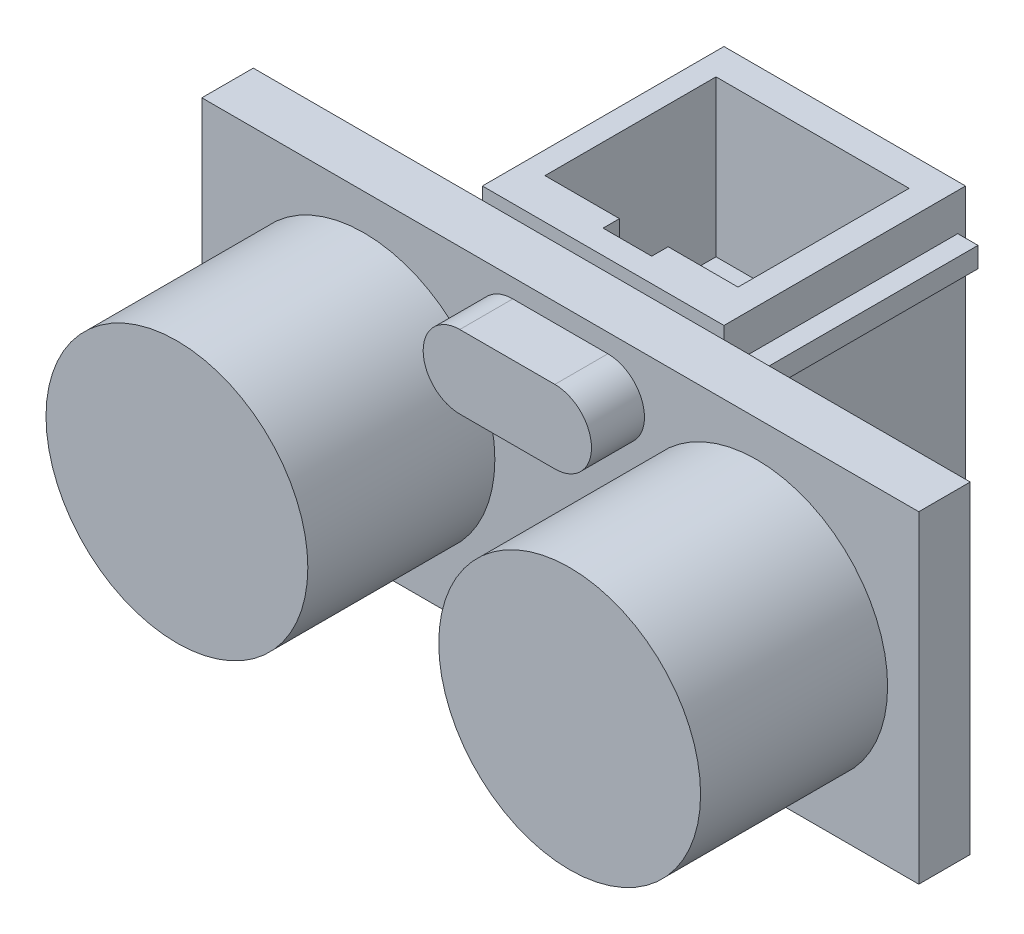
from build123d import *

# Parameters (mm, degrees)
SKETCH1_W           = 46
SKETCH1_H           = 20.7
BOSS_EXTRUDE1_DEPTH = 3.3
SKETCH2_R           = 8.4
BOSS_EXTRUDE2_DEPTH = 12
BOSS_EXTRUDE3_DEPTH = 3.4
SKETCH4_W           = 15.5
SKETCH4_H           = 21.5
BOSS_EXTRUDE4_DEPTH = 15.5
CUT_EXTRUDE1_DEPTH  = 36.729714524
SKETCH6_W           = 14
SKETCH6_H           = 1.3
BOSS_EXTRUDE5_DEPTH = 1.3
SKETCH7_W           = 14
SKETCH7_H           = 1.3
BOSS_EXTRUDE6_DEPTH = 1.3
CUT_EXTRUDE2_DEPTH  = 10


with BuildPart() as part:
    # Sketch1 → Boss-Extrude1 (new body)
    with BuildSketch(Plane.XY):
        Rectangle(SKETCH1_W, SKETCH1_H)
    extrude(amount=BOSS_EXTRUDE1_DEPTH)

    # Sketch2 → Boss-Extrude2 (add)
    with BuildSketch(Plane.XY.offset(3.3)):
        with Locations((-12.6, -0.35)):
            Circle(SKETCH2_R)
        with Locations((12.6, -0.35)):
            Circle(SKETCH2_R)
    extrude(amount=BOSS_EXTRUDE2_DEPTH)

    # Sketch3 → Boss-Extrude3 (add)
    with BuildSketch(Plane.XY.offset(3.3)):
        with BuildLine():
            Line((-3.05, 9.15), (3.05, 9.15))
            ThreePointArc((3.05, 9.15), (5.4, 6.8), (3.05, 4.45))
            Line((3.05, 4.45), (-3.05, 4.45))
            ThreePointArc((-3.05, 4.45), (-5.4, 6.8), (-3.05, 9.15))
        make_face()
    extrude(amount=BOSS_EXTRUDE3_DEPTH)

    # Sketch4 → Boss-Extrude4 (add)
    with BuildSketch(Plane(origin=(0, 0, 0), x_dir=(-1, 0, 0), z_dir=(0, 0, -1))):
        with Locations((0.55, 0.4)):
            Rectangle(SKETCH4_W, SKETCH4_H)
    extrude(amount=BOSS_EXTRUDE4_DEPTH)

    # Sketch5 → Cut-Extrude1 (cut, through all)
    with BuildSketch(Plane(origin=(7.2, 0, 0), x_dir=(0, 0, -1), z_dir=(1, 0, 0))):
        Polygon((2.7, -10.35), (15.5, -6.45), (17.762408334, -10.35), align=None)
    extrude(amount=-CUT_EXTRUDE1_DEPTH, mode=Mode.SUBTRACT)

    # Sketch6 → Boss-Extrude5 (add)
    with BuildSketch(Plane(origin=(7.2, 0, 0), x_dir=(0, 0, -1), z_dir=(1, 0, 0))):
        with Locations((8, 8.1)):
            Rectangle(SKETCH6_W, SKETCH6_H)
    extrude(amount=BOSS_EXTRUDE5_DEPTH)

    # Sketch7 → Boss-Extrude6 (add)
    with BuildSketch(Plane.ZY.offset(8.3)):
        with Locations((-8, 8.1)):
            Rectangle(SKETCH7_W, SKETCH7_H)
    extrude(amount=BOSS_EXTRUDE6_DEPTH)

    # Sketch8 → Cut-Extrude2 (cut)
    with BuildSketch(Plane(origin=(0, 11.15, 0), x_dir=(1, 0, 0), z_dir=(0, 1, 0))):
        Polygon((-6.867918302, 13.558476038), (-6.867918302, 2.582403773), (-2.085968941, 2.582403773), (-2.085968941, 1.529654964), (1.035267388, 1.529654964), (1.035267388, 2.582403773), (5.521426067, 2.582403773), (5.521426067, 13.558476038), align=None)
    extrude(amount=-CUT_EXTRUDE2_DEPTH, mode=Mode.SUBTRACT)


solid = part.part
